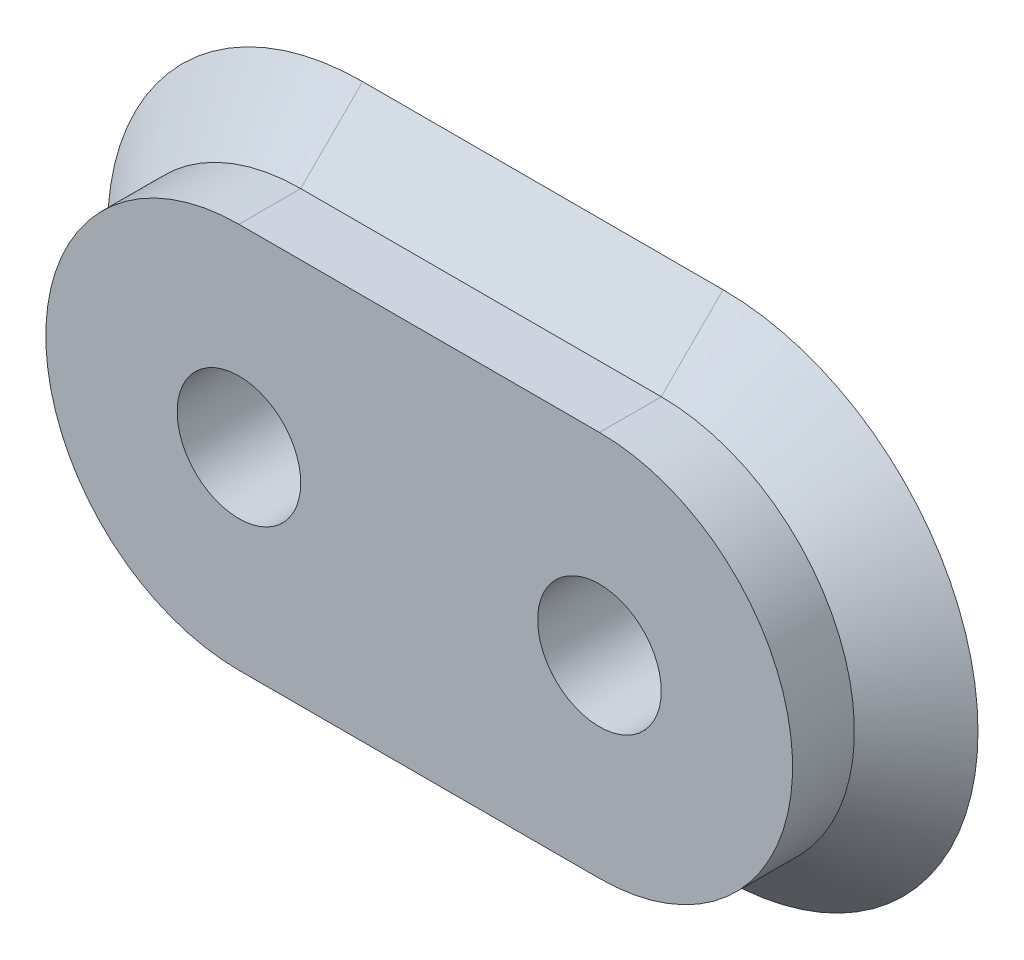
from build123d import *

# Parameters (mm, degrees)
BOSS_EXTRUDE1_DEPTH = 12
BOSS_EXTRUDE2_DEPTH = 12
CHAMFER1_SIZE       = 12
SKETCH3_R           = 12
CUT_EXTRUDE1_DEPTH  = 132.554171352


with BuildPart() as part:
    # Sketch1 → Boss-Extrude1 (new body)
    with BuildSketch(Plane.XY):
        with BuildLine():
            Line((0, 37.5), (70, 37.5))
            ThreePointArc((70, 37.5), (107.5, 0), (70, -37.5))
            Line((70, -37.5), (0, -37.5))
            ThreePointArc((0, -37.5), (-37.5, 0), (0, 37.5))
        make_face()
    extrude(amount=BOSS_EXTRUDE1_DEPTH)

    # Sketch2 → Boss-Extrude2 (add)
    with BuildSketch(Plane(origin=(0, 0, 0), x_dir=(-1, 0, 0), z_dir=(0, 0, -1))):
        with BuildLine():
            Line((0, -49.5), (-70, -49.5))
            ThreePointArc((-70, -49.5), (-119.5, 0), (-70, 49.5))
            Line((-70, 49.5), (0, 49.5))
            ThreePointArc((0, 49.5), (49.5, 0), (0, -49.5))
        make_face()
    extrude(amount=BOSS_EXTRUDE2_DEPTH)

    # Chamfer1
    chamfer1_edges = [part.edges().sort_by_distance(p)[0] for p in [
        (35, 49.5, 0),
        (119.5, 0, 0),
        (35, -49.5, 0),
        (-49.5, 0, 0),
    ]]
    chamfer(chamfer1_edges, length=CHAMFER1_SIZE - 0.0001)  # a hair under: the kernel refuses the full size

    # Sketch3 → Cut-Extrude1 (cut, through all)
    with BuildSketch(Plane.XY.offset(12)):
        Circle(SKETCH3_R)
        with Locations((70, 0)):
            Circle(SKETCH3_R)
    extrude(amount=-CUT_EXTRUDE1_DEPTH, mode=Mode.SUBTRACT)


solid = part.part
